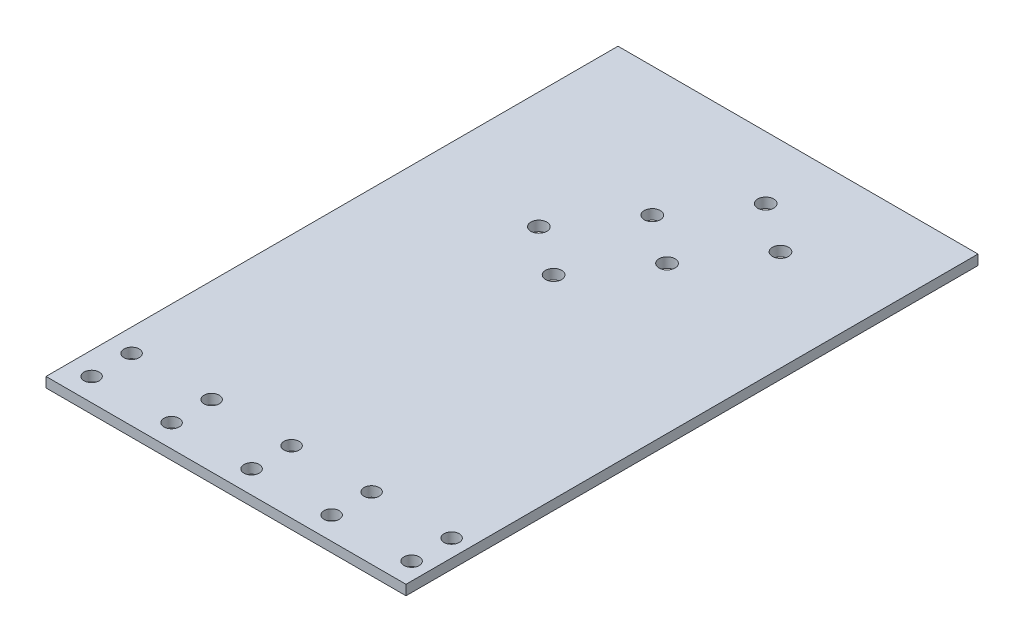
from build123d import *

# Parameters (mm, degrees)
SKETCH1_W           = 114.3
SKETCH1_H           = 181.61
BOSS_EXTRUDE1_DEPTH = 3.175
SKETCH2_R           = 2.413
CUT_EXTRUDE1_DEPTH  = 215.608393883
SKETCH3_R           = 2.5527
CUT_EXTRUDE2_DEPTH  = 215.608393883


with BuildPart() as part:
    # Sketch1 → Boss-Extrude1 (new body)
    with BuildSketch(Plane(origin=(0, 0, 0), x_dir=(1, 0, 0), z_dir=(0, 1, 0))):
        with Locations((57.15, 90.805)):
            Rectangle(SKETCH1_W, SKETCH1_H)
    extrude(amount=BOSS_EXTRUDE1_DEPTH)

    # Sketch2 → Cut-Extrude1 (cut, through all)
    with BuildSketch(Plane(origin=(0, 3.175, 0), x_dir=(1, 0, 0), z_dir=(0, 1, 0))):
        with Locations((7.239, 7.239)):
            Circle(SKETCH2_R)
        with Locations((7.239, 19.939)):
            Circle(SKETCH2_R)
        with Locations((32.639, 19.939)):
            Circle(SKETCH2_R)
        with Locations((58.039, 19.939)):
            Circle(SKETCH2_R)
        with Locations((83.439, 19.939)):
            Circle(SKETCH2_R)
        with Locations((108.839, 19.939)):
            Circle(SKETCH2_R)
        with Locations((32.639, 7.239)):
            Circle(SKETCH2_R)
        with Locations((58.039, 7.239)):
            Circle(SKETCH2_R)
        with Locations((83.439, 7.239)):
            Circle(SKETCH2_R)
        with Locations((108.839, 7.239)):
            Circle(SKETCH2_R)
    extrude(amount=-CUT_EXTRUDE1_DEPTH, mode=Mode.SUBTRACT)

    # Sketch3 → Cut-Extrude2 (cut, through all)
    with BuildSketch(Plane.XZ):
        with Locations((37.069991282, -119.411511373)):
            Circle(SKETCH3_R)
        with Locations((52.674837726, -108.48488026)):
            Circle(SKETCH3_R)
        with Locations((82.339912754, -150.850998032)):
            Circle(SKETCH3_R)
        with Locations((66.73506631, -161.777629144)):
            Circle(SKETCH3_R)
        with Locations((51.902528796, -140.594570258)):
            Circle(SKETCH3_R)
        with Locations((67.50737524, -129.667939146)):
            Circle(SKETCH3_R)
    extrude(amount=-CUT_EXTRUDE2_DEPTH, mode=Mode.SUBTRACT)


solid = part.part
